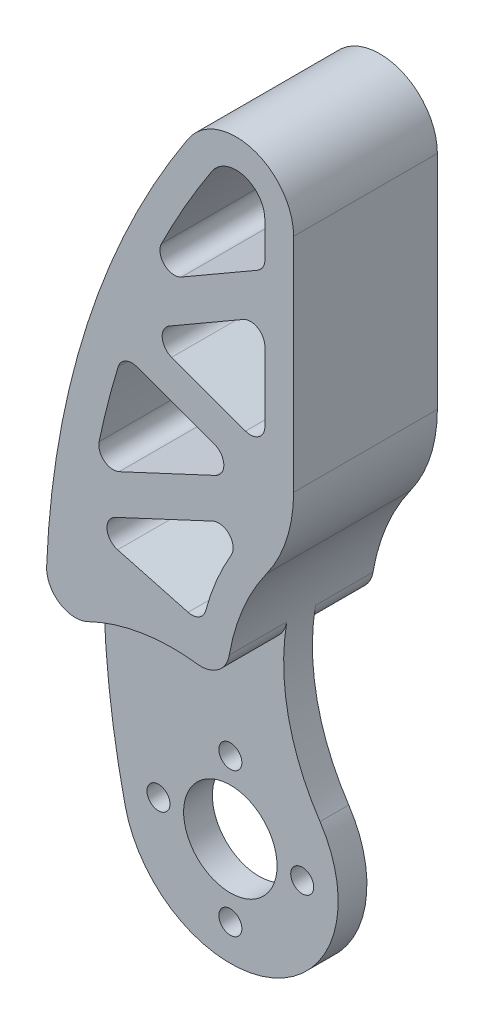
from build123d import *
from build123d.topology import SkipClean

# Parameters (mm, degrees)
SKETCH_1_R           = 15
SKETCH_1_R_2         = 6.5
SKETCH_1_R_3         = 1.6
EXTRUDE_1_DEPTH      = 4
EXTRUDE_START        = -4
EXTRUDE_3_DEPTH      = 4
EXTRUDE_4_DEPTH      = 8
EXTRUDE_4_DEPTH_BACK = 12
CUT_EXTRUDE_1_DEPTH  = 46


with BuildPart() as part:
    # 草图1 → 凸台-拉伸1 (new body)
    with BuildSketch(Plane.XY):
        Circle(SKETCH_1_R)
        Circle(SKETCH_1_R_2, mode=Mode.SUBTRACT)
        with Locations((0, 10)):
            Circle(SKETCH_1_R_3, mode=Mode.SUBTRACT)
        with Locations((10, 0)):
            Circle(SKETCH_1_R_3, mode=Mode.SUBTRACT)
        with Locations((0, -10)):
            Circle(SKETCH_1_R_3, mode=Mode.SUBTRACT)
        with Locations((-10, 0)):
            Circle(SKETCH_1_R_3, mode=Mode.SUBTRACT)
    extrude(amount=EXTRUDE_1_DEPTH)

    # 草图2 → 凸台-拉伸3 (add)
    with BuildSketch(Plane.XY.offset(4).offset(EXTRUDE_START)):
        with BuildLine():
            Line((16.8, 85), (16.8, 54.159799849))
            ThreePointArc((16.8, 54.159799849), (15.83854762, 48.033324147), (13.046629547, 42.49587991))
            ThreePointArc((13.046629547, 42.49587991), (7.420814059, 25.504374344), (12.472191289, 8.333333333))
            ThreePointArc((12.472191289, 8.333333333), (-5.937882388, 13.774670695), (-14.621995932, -3.346226976))
            ThreePointArc((-14.621995932, -3.346226976), (-15.737901413, 44.738127218), (2.117573463, 89.398315084))
            ThreePointArc((2.117573463, 89.398315084), (11.095712057, 92.663530919), (16.8, 85))
        make_face()
    extrude(amount=EXTRUDE_3_DEPTH)

    # 草图3 → 凸台-拉伸4 (add, two sides: drawn at the far end of the back side and taken through both)
    with SkipClean():  # the faces are left unmerged after this step: merging them gives an invalid solid
        with BuildSketch(Plane.XY.offset(4).offset(-EXTRUDE_4_DEPTH_BACK)):
            with BuildLine():
                Line((16.8, 54.159799849), (16.8, 85))
                ThreePointArc((16.8, 85), (11.095712057, 92.663530919), (2.117573463, 89.398315084))
                ThreePointArc((2.117573463, 89.398315084), (-11.916705707, 60.059804871), (-17.55757213, 28.030290369))
                ThreePointArc((-17.55757213, 28.030290369), (-15.746673, 24.526996644), (-11.810776072, 24.27973576))
                ThreePointArc((-11.810776072, 24.27973576), (-4.386649325, 26.64127076), (3.402697603, 26.784727906))
                ThreePointArc((3.402697603, 26.784727906), (6.286614818, 27.53779516), (7.849127177, 30.076031539))
                ThreePointArc((7.849127177, 30.076031539), (9.742150736, 36.581291134), (13.046629547, 42.49587991))
                ThreePointArc((13.046629547, 42.49587991), (15.83854762, 48.033324147), (16.8, 54.159799849))
            make_face()
        extrude(amount=EXTRUDE_4_DEPTH + EXTRUDE_4_DEPTH_BACK)
    add(part.part.scale(1), mode=Mode.REPLACE)  # the faces are merged on a copy

    # 草图5 → 切除-拉伸1 (cut)
    with BuildSketch(Plane(origin=(0, 0, -8), x_dir=(-1, 0, 0), z_dir=(0, 0, -1))):
        with BuildLine():
            Line((-12.8, 69.762395693), (-12.8, 60.082793322))
            ThreePointArc((-12.8, 60.082793322), (-11.947152873, 58.444489233), (-10.115959713, 58.20340808))
            Line((-10.115959713, 58.20340808), (0.167044148, 61.946115404))
            ThreePointArc((0.167044148, 61.946115404), (1.475393257, 63.65118916), (0.483003861, 65.557551453))
            Line((0.483003861, 65.557551453), (-9.8, 71.494446501))
            ThreePointArc((-9.8, 71.494446501), (-11.8, 71.494446501), (-12.8, 69.762395693))
        make_face()
        with BuildLine():
            Line((-11.8, 78.422649731), (-1.206357847, 72.306407582))
            ThreePointArc((-1.206357847, 72.306407582), (1.162211364, 72.580028303), (1.585705551, 74.926438557))
            ThreePointArc((1.585705551, 74.926438557), (-1.749223409, 81.170317372), (-5.458786731, 87.199157542))
            ThreePointArc((-5.458786731, 87.199157542), (-9.947856029, 88.83176546), (-12.8, 85))
            Line((-12.8, 85), (-12.8, 80.154700538))
            ThreePointArc((-12.8, 80.154700538), (-12.532050808, 79.154700538), (-11.8, 78.422649731))
        make_face()
        with BuildLine():
            Line((5.01005666, 58.38793894), (-5.776995128, 54.461773174))
            ThreePointArc((-5.776995128, 54.461773174), (-7.091051284, 52.669626708), (-5.938191364, 50.769772359))
            Line((-5.938191364, 50.769772359), (7.453099332, 44.525310955))
            ThreePointArc((7.453099332, 44.525310955), (9.539258698, 44.76945259), (10.256783773, 46.743490028))
            ThreePointArc((10.256783773, 46.743490028), (9.051891671, 51.949605837), (7.60645214, 57.094128298))
            ThreePointArc((7.60645214, 57.094128298), (6.586103601, 58.298616303), (5.01005666, 58.38793894))
        make_face()
        with BuildLine():
            Line((-2.123332063, 32.377143259), (7.681973135, 35.004466868))
            ThreePointArc((7.681973135, 35.004466868), (9.156724441, 36.762007035), (8.009571568, 38.748934095))
            Line((8.009571568, 38.748934095), (-5.543860738, 45.069003373))
            ThreePointArc((-5.543860738, 45.069003373), (-7.869208523, 44.601479118), (-8.112845962, 42.242144033))
            ThreePointArc((-8.112845962, 42.242144033), (-6.056960525, 38.136767143), (-4.572948137, 33.791828527))
            ThreePointArc((-4.572948137, 33.791828527), (-3.641181599, 32.577066199), (-2.123332063, 32.377143259))
        make_face()
    extrude(amount=-CUT_EXTRUDE_1_DEPTH, mode=Mode.SUBTRACT)


solid = part.part
